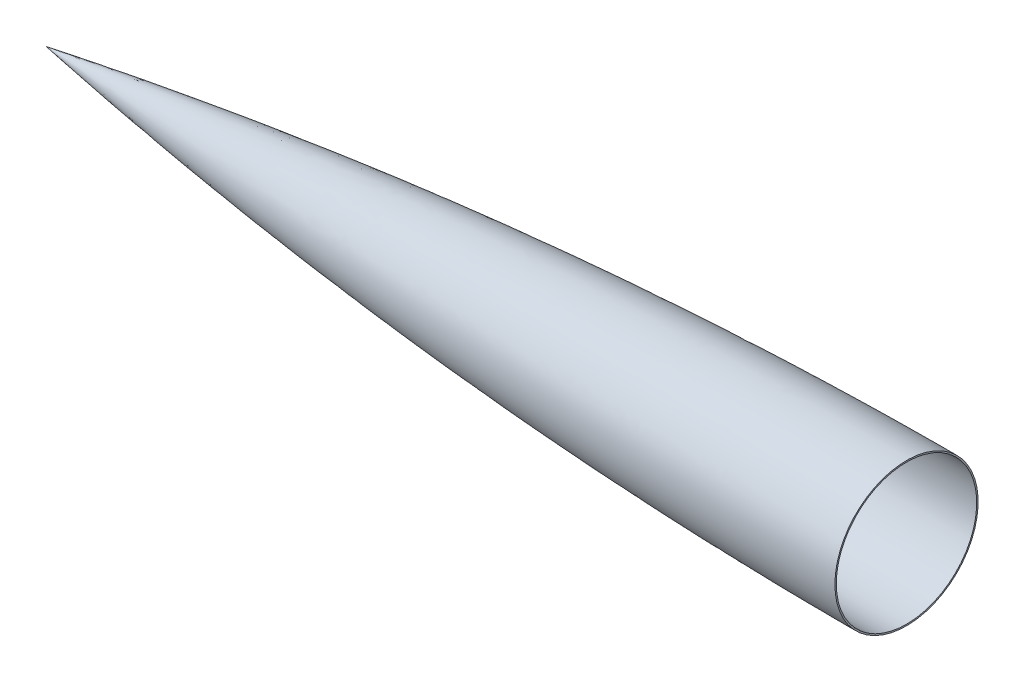
from build123d import *


# Read off the part's stored shape, not the designer's step: Shell3
with BuildPart() as part:
    # Sketch1 → Revolve1 (revolve)
    with BuildSketch(Plane.XY):
        with BuildLine():
            Line((426.643166324, 0), (1038.783166324, 0))
            Line((1038.783166324, 0), (1038.783166324, 50.9524))
            ThreePointArc((1038.783166324, 50.9524), (731.654721424, 38.192312702), (426.643166324, 0))
        make_face()
    revolve(axis=Axis((426.643166324, 0, 0), (1, 0, 0)))

    # Shell3 outline → Shell3 (revolve, cut)
    with BuildSketch(Plane.YX):
        with BuildLine():
            add(Edge.make_bspline(
                [(49.9491, 1038.783166324), (49.9491, 733.703854885), (0, 432.741276352)],
                knots=[0, 0, 0, 0.164465398, 0.164465398, 0.164465398], degree=2, weights=[1, 0.996620796, 1]))
            Line((49.9491, 1038.783166324), (0, 1038.783166324))
            Line((0, 1038.783166324), (0, 432.741276352))
        make_face()
    revolve(axis=Axis((0, 0, 0), (1, 0, 0)), mode=Mode.SUBTRACT)


solid = part.part
